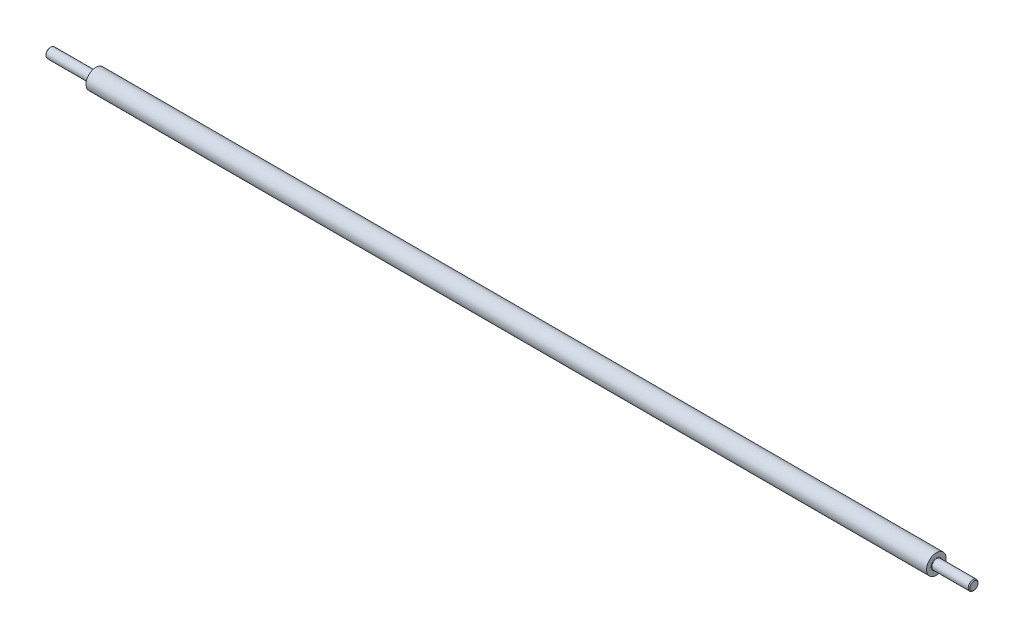
from build123d import *

# Parameters (mm, degrees)
CHAMFER1_SIZE = 0.5
FILLET1_R     = 0.3


with BuildPart() as part:
    # Sketch1 → Revolve1 (revolve)
    with BuildSketch(Plane.XY):
        Polygon((-608.6, 54.57), (-636.6, 54.57), (-636.6, 51.57), (-70.6, 51.57), (-70.6, 54.57), (-93.6, 54.57), (-93.6, 57.57), (-608.6, 57.57), align=None)
    revolve(axis=Axis((-24.960657764, 51.57, 0), (-1, 0, 0)))

    # Chamfer1
    chamfer1_edges = [part.edges().sort_by_distance(p)[0] for p in [
        (-70.6, 48.57, 0),
        (-636.6, 48.57, 0),
    ]]
    chamfer(chamfer1_edges, length=CHAMFER1_SIZE)

    # Fillet1
    fillet1_edges = [part.edges().sort_by_distance(p)[0] for p in [
        (-608.6, 48.57, 0),
        (-93.6, 48.57, 0),
    ]]
    fillet(fillet1_edges, radius=FILLET1_R)


solid = part.part
